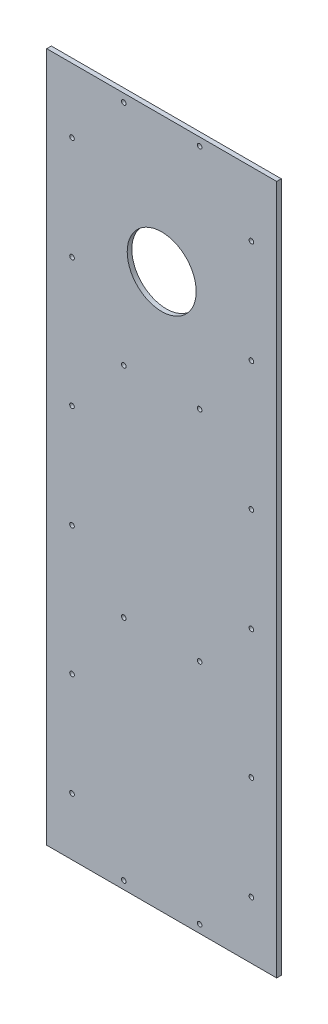
from build123d import *

# Parameters (mm, degrees)
SKETCH1_W           = 100
SKETCH1_H           = 300
BOSS_EXTRUDE1_DEPTH = 2
SKETCH2_R           = 1
CUT_EXTRUDE1_DEPTH  = 10
SKETCH3_R           = 15
CUT_EXTRUDE2_DEPTH  = 10
SKETCH5_R           = 1
CUT_EXTRUDE3_DEPTH  = 10


with BuildPart() as part:
    # Sketch1 → Boss-Extrude1 (new body)
    with BuildSketch(Plane.XY):
        Rectangle(SKETCH1_W, SKETCH1_H)
    extrude(amount=BOSS_EXTRUDE1_DEPTH)

    # Sketch2 → Cut-Extrude1 (cut)
    with BuildSketch(Plane.XY.offset(2)):
        with Locations((-39, 122)):
            Circle(SKETCH2_R)
        with Locations((-39, 77)):
            Circle(SKETCH2_R)
        with Locations((39, 122)):
            Circle(SKETCH2_R)
        with Locations((39, 77)):
            Circle(SKETCH2_R)
        with Locations((-39, 21)):
            Circle(SKETCH2_R)
        with Locations((-39, -24)):
            Circle(SKETCH2_R)
        with Locations((39, 21)):
            Circle(SKETCH2_R)
        with Locations((39, -24)):
            Circle(SKETCH2_R)
        with Locations((-39, -80)):
            Circle(SKETCH2_R)
        with Locations((-39, -125)):
            Circle(SKETCH2_R)
        with Locations((39, -80)):
            Circle(SKETCH2_R)
        with Locations((39, -125)):
            Circle(SKETCH2_R)
        with Locations((16.5, -146.5)):
            Circle(SKETCH2_R)
        with Locations((-16.5, -146.5)):
            Circle(SKETCH2_R)
        with Locations((-16.5, 146.5)):
            Circle(SKETCH2_R)
        with Locations((16.5, 146.5)):
            Circle(SKETCH2_R)
    extrude(amount=-CUT_EXTRUDE1_DEPTH, mode=Mode.SUBTRACT)

    # Sketch3 → Cut-Extrude2 (cut)
    with BuildSketch(Plane(origin=(0, 0, 0), x_dir=(-1, 0, 0), z_dir=(0, 0, -1))):
        with Locations((0, 91)):
            Circle(SKETCH3_R)
    extrude(amount=-CUT_EXTRUDE2_DEPTH, mode=Mode.SUBTRACT)

    # Sketch5 → Cut-Extrude3 (cut)
    with BuildSketch(Plane.XY.offset(2)):
        with Locations((-16.5, 47.5)):
            Circle(SKETCH5_R)
        with Locations((16.5, 47.5)):
            Circle(SKETCH5_R)
        with Locations((-16.5, -47.5)):
            Circle(SKETCH5_R)
        with Locations((16.5, -47.5)):
            Circle(SKETCH5_R)
    extrude(amount=-CUT_EXTRUDE3_DEPTH, mode=Mode.SUBTRACT)


solid = part.part
